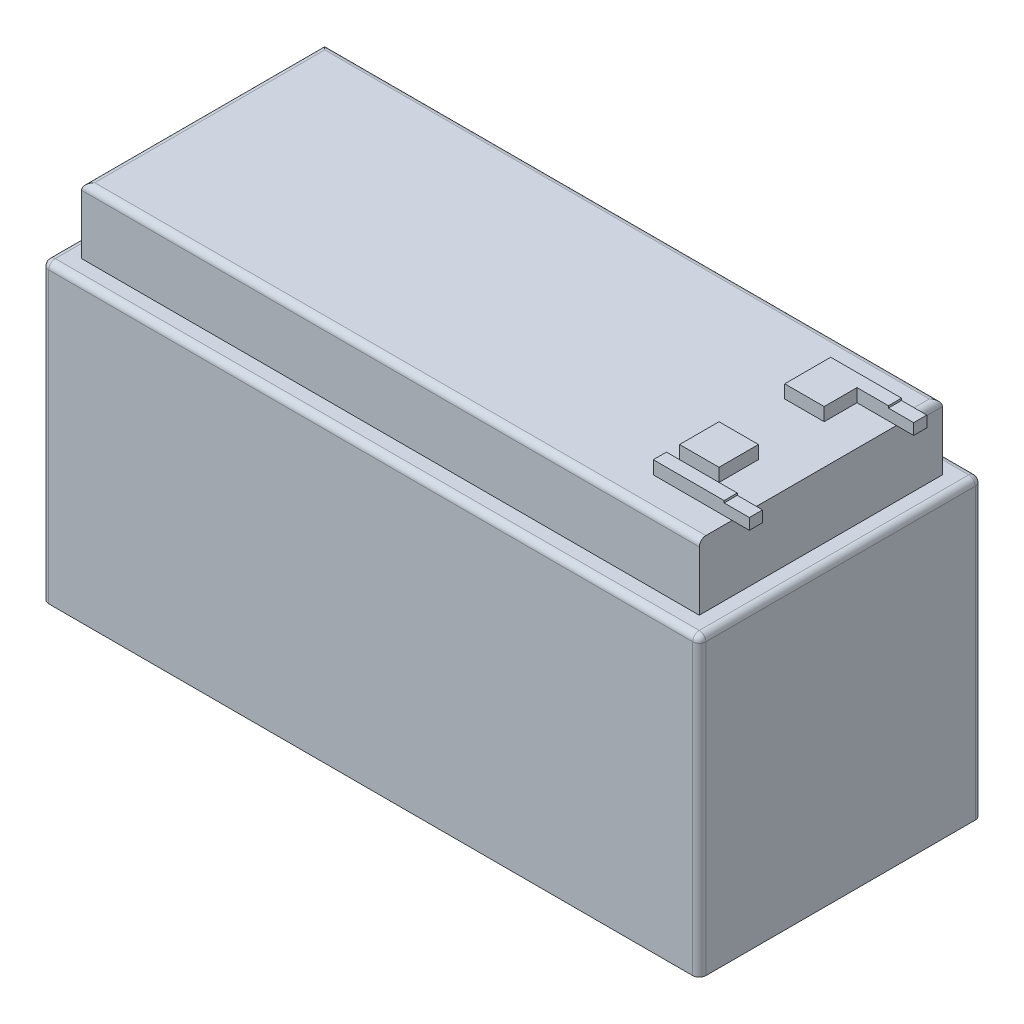
from build123d import *

# Parameters (mm, degrees)
SKETCH1_W           = 100
SKETCH1_H           = 43
BOSS_EXTRUDE1_DEPTH = 55
SKETCH2_W           = 100
SKETCH2_H           = 43
SKETCH2_W_2         = 94
SKETCH2_H_2         = 37
SKETCH2_W_3         = 6
SKETCH2_H_3         = 6
CUT_EXTRUDE1_DEPTH  = 10
SKETCH3_W           = 6
SKETCH3_H           = 6
BOSS_EXTRUDE2_DEPTH = 12
SKETCH7_R           = 2
CUT_EXTRUDE2_DEPTH  = 10
SKETCH4_W           = 6
SKETCH4_H           = 6
BOSS_EXTRUDE3_DEPTH = 12
BOSS_EXTRUDE4_DEPTH = 1
FILLET1_R           = 1


with BuildPart() as part:
    # Sketch1 → Boss-Extrude1 (new body)
    with BuildSketch(Plane(origin=(0, 0, 0), x_dir=(1, 0, 0), z_dir=(0, 1, 0))):
        Rectangle(SKETCH1_W, SKETCH1_H)
    extrude(amount=BOSS_EXTRUDE1_DEPTH)

    # Sketch2 → Cut-Extrude1 (cut)
    # profile 1 of 3: a face of its own
    with BuildSketch(Plane(origin=(0, 55, 0), x_dir=(1, 0, 0), z_dir=(0, 1, 0))):
        Rectangle(SKETCH2_W, SKETCH2_H)
        Rectangle(SKETCH2_W_2, SKETCH2_H_2, mode=Mode.SUBTRACT)
    # profile 2 of 3: a face of its own
    with BuildSketch(Plane(origin=(0, 55, 0), x_dir=(1, 0, 0), z_dir=(0, 1, 0))):
        with Locations((38, 9.5)):
            Rectangle(SKETCH2_W_3, SKETCH2_H_3)
    # profile 3 of 3: a face of its own
    with BuildSketch(Plane(origin=(0, 55, 0), x_dir=(1, 0, 0), z_dir=(0, 1, 0))):
        with Locations((38, -6.5)):
            Rectangle(SKETCH2_W_3, SKETCH2_H_3)
    extrude(amount=-CUT_EXTRUDE1_DEPTH, mode=Mode.SUBTRACT)

    # Sketch3 → Boss-Extrude2 (add)
    with BuildSketch(Plane(origin=(0, 45, 0), x_dir=(1, 0, 0), z_dir=(0, 1, 0))):
        with Locations((38, -6.5)):
            Rectangle(SKETCH3_W, SKETCH3_H)
    extrude(amount=BOSS_EXTRUDE2_DEPTH)

    # Sketch7 → Cut-Extrude2 (cut)
    with BuildSketch(Plane.XZ):
        with Locations(Location((0, 0, 0), (0, 0, 270))):
            Circle(SKETCH7_R)
    extrude(amount=-CUT_EXTRUDE2_DEPTH, mode=Mode.SUBTRACT)

    # Sketch4 → Boss-Extrude3 (add)
    with BuildSketch(Plane(origin=(0, 45, 0), x_dir=(1, 0, 0), z_dir=(0, 1, 0))):
        with Locations((38, 9.5)):
            Rectangle(SKETCH4_W, SKETCH4_H)
    extrude(amount=BOSS_EXTRUDE3_DEPTH)

    # Sketch5 → Boss-Extrude4 (add, symmetric)
    with BuildSketch(Plane.XY.offset(-12.5)):
        Polygon((35, 55), (35, 57), (45.779010746, 57), (45.779010746, 56.689423242), (49.616852111, 56.689423242), (49.616852111, 55), align=None)
    boss_extrude4 = extrude(amount=BOSS_EXTRUDE4_DEPTH, both=True)

    # Mirror1: Boss-Extrude4 across plane
    add(boss_extrude4.mirror(Plane.XY))

    # Fillet1
    # the kernel refuses this fillet: 1 mm, written as the material it takes off along each edge
    with BuildSketch(Plane(origin=(-49, 44, 20.5), x_dir=(0, 1, 0), z_dir=(0, 0, 1))) as fillet1_piece_1_section:
        Polygon((0, 0), (FILLET1_R * 1.02, 0), (FILLET1_R * 1.02, FILLET1_R * 1.02), (0, FILLET1_R * 1.02), align=None)
    fillet1_piece_1 = extrude(amount=FILLET1_R * 1.02, mode=Mode.PRIVATE)
    fillet1_piece_1 = fillet1_piece_1 - Plane(origin=(-49, 44, 20.5), x_dir=(0.7071067811865475, -0.7071067811865475, 0), z_dir=(0, 0, 1)) * Sphere(FILLET1_R, mode=Mode.PRIVATE)
    add(fillet1_piece_1, mode=Mode.SUBTRACT)
    with BuildSketch(Plane(origin=(49, 44, 20.5), x_dir=(1, 0, 0), z_dir=(0, 0, 1))) as fillet1_piece_2_section:
        Polygon((0, 0), (FILLET1_R * 1.02, 0), (FILLET1_R * 1.02, FILLET1_R * 1.02), (0, FILLET1_R * 1.02), align=None)
    fillet1_piece_2 = extrude(amount=FILLET1_R * 1.02, mode=Mode.PRIVATE)
    fillet1_piece_2 = fillet1_piece_2 - Plane(origin=(49, 44, 20.5), x_dir=(-0.7071067811865475, -0.7071067811865475, 0), z_dir=(0, 0, 1)) * Sphere(FILLET1_R, mode=Mode.PRIVATE)
    add(fillet1_piece_2, mode=Mode.SUBTRACT)
    with BuildSketch(Plane(origin=(49, 44, -20.5), x_dir=(0, 1, 0), z_dir=(1, 0, 0))) as fillet1_piece_3_section:
        Polygon((0, 0), (FILLET1_R * 1.02, 0), (FILLET1_R * 1.02, -FILLET1_R * 1.02), (0, -FILLET1_R * 1.02), align=None)
    fillet1_piece_3 = extrude(amount=FILLET1_R * 1.02, mode=Mode.PRIVATE)
    fillet1_piece_3 = fillet1_piece_3 - Plane(origin=(49, 44, -20.5), x_dir=(0, -0.7071067811865475, 0.7071067811865475), z_dir=(1, 0, 0)) * Sphere(FILLET1_R, mode=Mode.PRIVATE)
    add(fillet1_piece_3, mode=Mode.SUBTRACT)
    with BuildSketch(Plane(origin=(-49, 44, -20.5), x_dir=(-1, 0, 0), z_dir=(0, 1, 0))) as fillet1_piece_4_section:
        Polygon((0, 0), (FILLET1_R * 1.02, 0), (FILLET1_R * 1.02, -FILLET1_R * 1.02), (0, -FILLET1_R * 1.02), align=None)
    fillet1_piece_4 = extrude(amount=FILLET1_R * 1.02, mode=Mode.PRIVATE)
    fillet1_piece_4 = fillet1_piece_4 - Plane(origin=(-49, 44, -20.5), x_dir=(0.7071067811865475, 0, 0.7071067811865475), z_dir=(0, 1, 0)) * Sphere(FILLET1_R, mode=Mode.PRIVATE)
    add(fillet1_piece_4, mode=Mode.SUBTRACT)
    with BuildSketch(Plane(origin=(-50, -2.5, 21.5), x_dir=(1, 0, 0), z_dir=(0, 1, 0)), Plane(origin=(-50, -2.5, -21.5), x_dir=(0, 0, 1), z_dir=(0, 1, 0))) as fillet1_piece_5:
        with BuildLine():
            CenterArc((FILLET1_R, FILLET1_R), FILLET1_R, 180, 90)
            Line((0, FILLET1_R), (0, 0))
            Line((0, 0), (FILLET1_R, 0))
        make_face()
    extrude(amount=46.5, mode=Mode.SUBTRACT)
    with BuildSketch(Plane(origin=(50, -2.5, 21.5), x_dir=(-1, 0, 0), z_dir=(0, 1, 0)), Plane(origin=(50, -2.5, -21.5), x_dir=(0, 0, 1), z_dir=(0, 1, 0))) as fillet1_piece_6:
        with BuildLine():
            CenterArc((FILLET1_R, -FILLET1_R), FILLET1_R, 90, 90)
            Line((0, -FILLET1_R), (0, 0))
            Line((0, 0), (FILLET1_R, 0))
        make_face()
    extrude(amount=46.5, mode=Mode.SUBTRACT)
    with BuildSketch(Plane(origin=(49, 45, -21.5), x_dir=(0, 0, 1), z_dir=(-1, 0, 0))) as fillet1_piece_7:
        with BuildLine():
            CenterArc((FILLET1_R, -FILLET1_R), FILLET1_R, 90, 90)
            Line((0, -FILLET1_R), (0, 0))
            Line((0, 0), (FILLET1_R, 0))
        make_face()
    extrude(amount=98, mode=Mode.SUBTRACT)
    with BuildSketch(Plane(origin=(-50, 45, -20.5), x_dir=(1, 0, 0), z_dir=(0, 0, 1))) as fillet1_piece_8:
        with BuildLine():
            CenterArc((FILLET1_R, -FILLET1_R), FILLET1_R, 90, 90)
            Line((0, -FILLET1_R), (0, 0))
            Line((0, 0), (FILLET1_R, 0))
        make_face()
    extrude(amount=41, mode=Mode.SUBTRACT)
    with BuildSketch(Plane(origin=(-49, 45, 21.5), x_dir=(0, -1, 0), z_dir=(1, 0, 0))) as fillet1_piece_9:
        with BuildLine():
            CenterArc((FILLET1_R, FILLET1_R), FILLET1_R, 180, 90)
            Line((0, FILLET1_R), (0, 0))
            Line((0, 0), (FILLET1_R, 0))
        make_face()
    extrude(amount=98, mode=Mode.SUBTRACT)
    with BuildSketch(Plane(origin=(50, 45, 20.5), x_dir=(0, -1, 0), z_dir=(0, 0, -1))) as fillet1_piece_10:
        with BuildLine():
            CenterArc((FILLET1_R, FILLET1_R), FILLET1_R, 180, 90)
            Line((0, FILLET1_R), (0, 0))
            Line((0, 0), (FILLET1_R, 0))
        make_face()
    extrude(amount=41, mode=Mode.SUBTRACT)
    with BuildSketch(Plane(origin=(47, 55, -13.5), x_dir=(0, -1, 0), z_dir=(0, 0, -1))) as fillet1_piece_11:
        with BuildLine():
            CenterArc((FILLET1_R, FILLET1_R), FILLET1_R, 180, 90)
            Line((0, FILLET1_R), (0, 0))
            Line((0, 0), (FILLET1_R, 0))
        make_face()
    extrude(amount=7.5, mode=Mode.SUBTRACT)
    with BuildSketch(Plane(origin=(-49.5, 55, 18.5), x_dir=(0, -1, 0), z_dir=(1, 0, 0)), Plane(origin=(49.5, 55, -18.5), x_dir=(0, -1, 0), z_dir=(-1, 0, 0))) as fillet1_piece_12:
        with BuildLine():
            CenterArc((FILLET1_R, FILLET1_R), FILLET1_R, 180, 90)
            Line((0, FILLET1_R), (0, 0))
            Line((0, 0), (FILLET1_R, 0))
        make_face()
    extrude(amount=99, mode=Mode.SUBTRACT)
    with BuildSketch(Plane(origin=(-47, 55, -21), x_dir=(0, -1, 0), z_dir=(0, 0, 1))) as fillet1_piece_13:
        with BuildLine():
            CenterArc((FILLET1_R, FILLET1_R), FILLET1_R, 180, 90)
            Line((0, FILLET1_R), (0, 0))
            Line((0, 0), (FILLET1_R, 0))
        make_face()
    extrude(amount=42, mode=Mode.SUBTRACT)


solid = part.part
